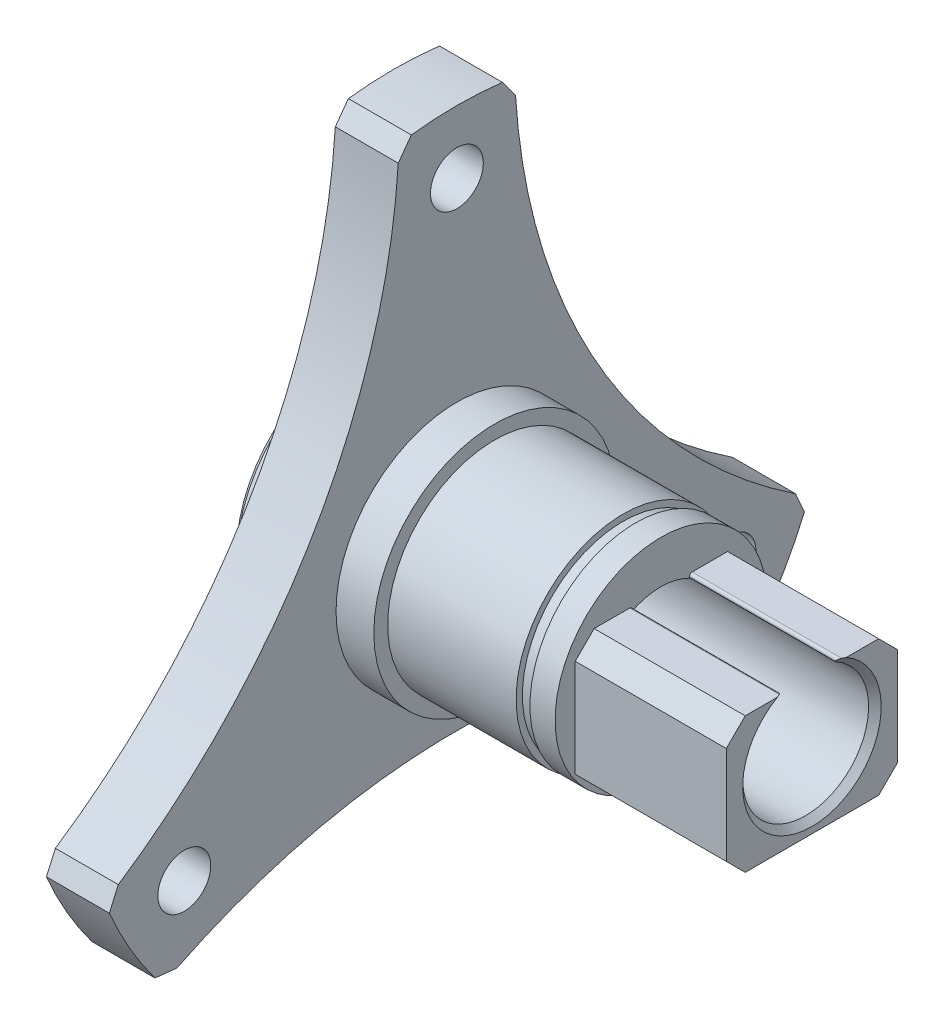
from build123d import *

# Parameters (mm, degrees)
SKETCH_2_R               = 5
CUT_EXTRUDE_1_DEPTH      = 49.84301383
CUT_EXTRUDE_START        = -8
SKETCH_3_R               = 8
CUT_EXTRUDE_2_DEPTH      = 8
CHAMFER_1_SIZE2          = 1.732050808
CHAMFER_1_SIZE           = 3
HOLE_WIZARD_M5_1_D       = 4.2
CUT_EXTRUDE_3_DEPTH      = 48.428261617
PATTERN_CIRCULAR_1_COUNT = 3
CHAMFER_4_SIZE           = 0.5
EXTRUDE_START            = 12
EXTRUDE_1_DEPTH          = 12
CHAMFER_5_SIZE           = 1.5
CHAMFER_6_SIZE           = 0.5
FILLET_1_R               = 0.2


# Some blends are built 0.0001 mm under size
with BuildPart() as part:
    # 草图1 → 旋转1 (revolve)
    with BuildSketch(Plane.XY, mode=Mode.PRIVATE) as revolve_1_sk:
        Polygon((0, 0), (0, 10), (3, 10), (3, 30), (8, 30), (8, 9.6), (11, 9.6), (11, 8.5), (21.2, 8.5), (21.2, 8), (22.2, 8), (22.2, 8.4), (24.2, 8.4), (24.2, 0), align=None)
    revolve(revolve_1_sk.sketch.rotate(Axis((24.2, 0, 0), (-1, 0, 0)), 90), axis=Axis((24.2, 0, 0), (-1, 0, 0)))

    # 草图2 → 切除-拉伸1 (cut, through all)
    with BuildSketch(Plane(origin=(24.2, 0, 0), x_dir=(0, 0, -1), z_dir=(1, 0, 0))):
        Circle(SKETCH_2_R)
    extrude(amount=-CUT_EXTRUDE_1_DEPTH, mode=Mode.SUBTRACT)

    # 草图3 → 切除-拉伸2 (cut)
    with BuildSketch(Plane.ZY.offset(CUT_EXTRUDE_START)):
        with Locations(Location((0, 0, 0), (0, 0, 180))):
            Circle(SKETCH_3_R)
    extrude(amount=CUT_EXTRUDE_2_DEPTH, mode=Mode.SUBTRACT)

    # 倒角1
    chamfer_1_edges = [part.edges().sort_by_distance(p)[0] for p in [
        (8, 0, 5),
    ]]
    chamfer_1_side = [part.faces().sort_by_distance(p)[0] for p in [
        (8, 0, 5.034641016),
    ]]
    chamfer(chamfer_1_edges, length=CHAMFER_1_SIZE - 0.0001, length2=CHAMFER_1_SIZE2 - 0.0001, reference=chamfer_1_side[0])  # a hair under: the kernel refuses the full size

    # M5 螺纹孔1 (through all)
    with Locations(Plane(origin=(3, 25, 0), x_dir=(0, 0, -1), z_dir=(-1, 0, 0))):
        with Locations((0, 0), (-21.650635095, 37.5), (21.650635095, 37.5)):
            Hole(HOLE_WIZARD_M5_1_D / 2)

    # 草图4 → 切除-拉伸3 (cut, through all)
    with BuildSketch(Plane.ZY.offset(-3)):
        with BuildLine():
            ThreePointArc((-27.710194429, -21.380952381), (0, -35), (27.710194429, -21.380952381))
            ThreePointArc((27.710194429, -21.380952381), (0, -13), (-27.710194429, -21.380952381))
        make_face()
    cut_extrude_3 = extrude(amount=-CUT_EXTRUDE_3_DEPTH, mode=Mode.SUBTRACT)

    # 阵列(圆周)1: 切除-拉伸3 ×3 about axis
    pattern_circular_1_axis = Axis((0, 0, 0), (1, 0, 0))
    for i in range(1, PATTERN_CIRCULAR_1_COUNT):
        add(cut_extrude_3.rotate(pattern_circular_1_axis, i * 360 / PATTERN_CIRCULAR_1_COUNT), mode=Mode.SUBTRACT)

    # 倒角2
    # the kernel refuses this chamfer: 1.262336382, 1 mm, written as the material it takes off along each edge
    with BuildSketch(Plane(origin=(-0.323534522, -18.801587302, -23.377346191), x_dir=(0, 0.7894182220381707, -0.6138557409637001), z_dir=(1, 0, 0)), Plane(origin=(-0.323534522, -10.844582024, 27.97132533), x_dir=(0, -0.9263237769525716, -0.3767283640135453), z_dir=(1, 0, 0)), Plane(origin=(-0.323534522, 29.646169325, -4.593979139), x_dir=(0, 0.13690555491440626, 0.9905841049772496), z_dir=(1, 0, 0))) as chamfer_2_piece_1:
        with BuildLine():
            Line((0.983994902, 0), (-0.239625676, 1.264429883))
            ThreePointArc((-0.239625676, 1.264429883), (-0.119678092, 0.653717986), (0, 0))
            ThreePointArc((0, 0), (0.509546154, -0.004029497), (0.983994902, 0))
        make_face()
    extrude(amount=11.647069044, mode=Mode.SUBTRACT)
    with BuildSketch(Plane(origin=(-0.323534522, -10.844582024, -27.97132533), x_dir=(0, 0.5426204152715339, 0.8399780264569711), z_dir=(1, 0, 0)), Plane(origin=(-0.323534522, 29.646169325, 4.593979139), x_dir=(0, -0.9987525171682211, 0.04993405100872917), z_dir=(1, 0, 0))) as chamfer_2_piece_2:
        with BuildLine():
            Line((1.28693566, 0), (-0.183218517, 0.966786917))
            ThreePointArc((-0.183218517, 0.966786917), (-0.098835833, 0.499884984), (0, 0))
            ThreePointArc((0, 0), (0.664569743, 0.004136227), (1.28693566, 0))
        make_face()
    extrude(amount=11.647069044, mode=Mode.SUBTRACT)
    with BuildSketch(Plane(origin=(-0.323534522, -18.801587302, 23.377346191), x_dir=(0, 0.7894182220381672, 0.6138557409637047), z_dir=(1, 0, 0))) as chamfer_2_piece_3:
        with BuildLine():
            Line((0.983994902, 0), (-0.239625676, -1.264429883))
            ThreePointArc((-0.239625676, -1.264429883), (-0.119678092, -0.653717986), (0, 0))
            ThreePointArc((0, 0), (0.509546154, 0.004029497), (0.983994902, 0))
        make_face()
    extrude(amount=11.647069044, mode=Mode.SUBTRACT)

    # 倒角4
    chamfer_4_edges = [part.edges().sort_by_distance(p)[0] for p in [
        (0, 0, 10),
    ]]
    chamfer(chamfer_4_edges, length=CHAMFER_4_SIZE)

    # 草图7 → 凸台-拉伸1 (add)
    with BuildSketch(Plane(origin=(24.2, 0, 0), x_dir=(0, 0, -1), z_dir=(1, 0, 0)).offset(EXTRUDE_START)):
        with BuildLine():
            Line((-6.8, -6), (6.8, -6))
            Line((6.8, -6), (6.8, 4.769696007))
            Line((6.8, 4.769696007), (1.5, 4.769696007))
            ThreePointArc((1.5, 4.769696007), (0, -5), (-1.5, 4.769696007))
            Line((-1.5, 4.769696007), (-6.8, 4.769696007))
            Line((-6.8, 4.769696007), (-6.8, -6))
        make_face()
    extrude(amount=-EXTRUDE_1_DEPTH)

    # 倒角5
    # the kernel refuses this chamfer: 1.5 mm, written as the material it takes off along each edge
    with BuildSketch(Plane(origin=(40.057524482, 4.769696007, 6.8), x_dir=(0, 0, -1), z_dir=(-1, 0, 0)), Plane(origin=(40.057524482, -6, 6.8), x_dir=(0, 1, 0), z_dir=(-1, 0, 0))) as chamfer_5_piece_1:
        Polygon((CHAMFER_5_SIZE, 0), (0, CHAMFER_5_SIZE), (0, 0), align=None)
    extrude(amount=15.857524482, mode=Mode.SUBTRACT)
    with BuildSketch(Plane(origin=(40.057524482, -6, -6.8), x_dir=(0, 1, 0), z_dir=(-1, 0, 0)), Plane(origin=(40.057524482, 4.769696007, -6.8), x_dir=(0, 0, 1), z_dir=(-1, 0, 0))) as chamfer_5_piece_2:
        Polygon((CHAMFER_5_SIZE, 0), (0, -CHAMFER_5_SIZE), (0, 0), align=None)
    extrude(amount=15.857524482, mode=Mode.SUBTRACT)

    # 倒角6
    chamfer_6_edges = [part.edges().sort_by_distance(p)[0] for p in [
        (36.2, -5, 0),
    ]]
    chamfer(chamfer_6_edges, length=CHAMFER_6_SIZE)

    # 圆角1
    # the kernel refuses this fillet: 0.2 mm, written as the material it takes off along each edge
    with BuildSketch(Plane(origin=(38.153768211, 4.769696007, 1.5), x_dir=(0, -0.3904189103265273, 0.9206373197190341), z_dir=(-1, 0, 0))) as fillet_1_piece_1:
        with BuildLine():
            CenterArc((0.981696018, 0.199071541), FILLET_1_R, 112.980567733, 151.496467657)
            Line((0.903612236, 0.383199004), (0, 0))
            ThreePointArc((0, 0), (0.481223538, 0.023211487), (0.962447076, 0))
        make_face()
    extrude(amount=13.953768211, mode=Mode.SUBTRACT)
    with BuildSketch(Plane(origin=(38.153768211, 4.769696007, -1.5), x_dir=(0, -0.39041891032652715, -0.9206373197190343), z_dir=(-1, 0, 0))) as fillet_1_piece_2:
        with BuildLine():
            CenterArc((0.981696018, -0.199071541), FILLET_1_R, 95.52296461, 151.496467657)
            Line((0.903612236, -0.383199004), (0, 0))
            ThreePointArc((0, 0), (0.481223538, -0.023211487), (0.962447076, 0))
        make_face()
    extrude(amount=13.953768211, mode=Mode.SUBTRACT)


solid = part.part
